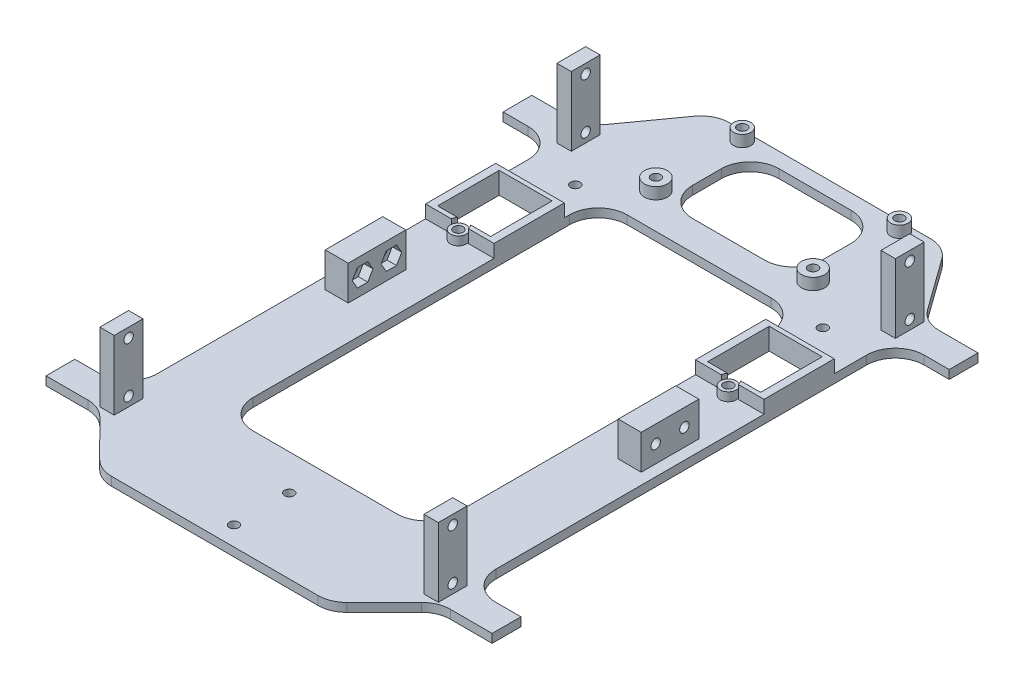
from build123d import *

# Parameters (mm, degrees)
SKETCH1_R               = 1.65
SKETCH1_W               = 70
SKETCH1_H               = 130
SKETCH1_W_2             = 45
SKETCH1_H_2             = 30
SKETCH1_W_3             = 18.4
SKETCH1_H_3             = 21.4
BOSS_EXTRUDE1_DEPTH     = 3
SKETCH3_W               = 5
SKETCH3_H               = 10
BOSS_EXTRUDE2_DEPTH     = 24
CUT_EXTRUDE1_DEPTH      = 186.477425086
CUT_EXTRUDE1_DEPTH_BACK = 186.477425086
SKETCH4_R               = 1.65
FILLET1_R               = 10
SKETCH5_W               = 8
SKETCH5_H               = 20
BOSS_EXTRUDE3_DEPTH     = 12
CUT_EXTRUDE2_DEPTH      = 181.658642795
CUT_EXTRUDE2_DEPTH_BACK = 181.658642795
SKETCH6_R               = 1.65
CUT_EXTRUDE3_DEPTH      = 3.3
CUT_EXTRUDE4_DEPTH      = 3.3
BOSS_EXTRUDE4_START     = -3
SKETCH9_R               = 2.75
BOSS_EXTRUDE4_DEPTH     = 6
CUT_EXTRUDE5_DEPTH      = 232.602495715
CUT_EXTRUDE5_DEPTH_BACK = 232.602495715
SKETCH10_R              = 1.65
BOSS_EXTRUDE6_DEPTH     = 4.5
SKETCH14_R              = 4
SKETCH14_R_2            = 1.65
SKETCH14_R_3            = 3
BOSS_EXTRUDE7_DEPTH     = 4


with BuildPart() as part:
    # Sketch1 → Boss-Extrude1 (new body)
    with BuildSketch(Plane(origin=(0, 0, 0), x_dir=(1, 0, 0), z_dir=(0, 1, 0))):
        Polygon((-154.243398335, 85.558014227), (-74.243398335, 85.558014227), (-55.443398335, 59.458014227), (-36.743398335, 59.458014227), (-36.743398335, 49.458014227), (-55.443398335, 49.458014227), (-55.443398335, -99.341985773), (-36.743398335, -99.341985773), (-36.743398335, -109.341985773), (-55.443398335, -109.341985773), (-74.243398335, -128.191985773), (-154.243398335, -128.191985773), (-173.043398335, -109.341985773), (-191.743398335, -109.341985773), (-191.743398335, -99.341985773), (-173.043398335, -99.341985773), (-173.043398335, 49.458014227), (-191.743398335, 49.458014227), (-191.743398335, 59.458014227), (-173.043398335, 59.458014227), align=None)
        with Locations(Location((-114.243398335, -121.541985773, 0), (0, 0, 270))):
            Circle(SKETCH1_R, mode=Mode.SUBTRACT)
        with Locations(Location((-114.243398335, -102.341985773, 0), (0, 0, 270))):
            Circle(SKETCH1_R, mode=Mode.SUBTRACT)
        with Locations(Location((-141.543398335, 82.358014227, 0), (0, 0, 270))):
            Circle(SKETCH1_R, mode=Mode.SUBTRACT)
        with Locations(Location((-86.943398335, 82.358014227, 0), (0, 0, 270))):
            Circle(SKETCH1_R, mode=Mode.SUBTRACT)
        with Locations(Location((-157.243398335, 40.058014227, 0), (0, 0, 270))):
            Circle(SKETCH1_R, mode=Mode.SUBTRACT)
        with Locations(Location((-71.243398335, 40.058014227, 0), (0, 0, 270))):
            Circle(SKETCH1_R, mode=Mode.SUBTRACT)
        with Locations(Location((-141.543398335, 52.358014227, 0), (0, 0, 270))):
            Circle(SKETCH1_R, mode=Mode.SUBTRACT)
        with Locations(Location((-86.943398335, 52.358014227, 0), (0, 0, 270))):
            Circle(SKETCH1_R, mode=Mode.SUBTRACT)
        with Locations((-114.243398335, -24.941985773)):
            Rectangle(SKETCH1_W, SKETCH1_H, mode=Mode.SUBTRACT)
        with Locations((-114.243398335, 65.308014227)):
            Rectangle(SKETCH1_W_2, SKETCH1_H_2, mode=Mode.SUBTRACT)
        with Locations((-161.143398335, 16.021247588)):
            Rectangle(SKETCH1_W_3, SKETCH1_H_3, mode=Mode.SUBTRACT)
        with Locations((-67.343398335, 16.021247588)):
            Rectangle(SKETCH1_W_3, SKETCH1_H_3, mode=Mode.SUBTRACT)
    extrude(amount=BOSS_EXTRUDE1_DEPTH)

    # Sketch3 → Boss-Extrude2 (add)
    with BuildSketch(Plane(origin=(0, 3, 0), x_dir=(1, 0, 0), z_dir=(0, 1, 0))):
        with Locations((-57.943398335, 54.458014227)):
            Rectangle(SKETCH3_W, SKETCH3_H)
        with Locations((-170.543398335, -104.341985773)):
            Rectangle(SKETCH3_W, SKETCH3_H)
        with Locations((-57.943398335, -104.341985773)):
            Rectangle(SKETCH3_W, SKETCH3_H)
        with Locations((-170.543398335, 54.458014227)):
            Rectangle(SKETCH3_W, SKETCH3_H)
    extrude(amount=BOSS_EXTRUDE2_DEPTH)

    # Sketch4 → Cut-Extrude1 (cut, two sides: drawn at the far end of the back side and taken through both)
    with BuildSketch(Plane(origin=(-168.043398335, 0, 0), x_dir=(0, 0, -1), z_dir=(1, 0, 0)).offset(-CUT_EXTRUDE1_DEPTH_BACK)):
        with Locations((-104.341985773, 23.75)):
            Circle(SKETCH4_R)
        with Locations((-104.341985773, 6.25)):
            Circle(SKETCH4_R)
        with Locations((54.458014227, 23.75)):
            Circle(SKETCH4_R)
        with Locations((54.458014227, 6.25)):
            Circle(SKETCH4_R)
    extrude(amount=CUT_EXTRUDE1_DEPTH + CUT_EXTRUDE1_DEPTH_BACK, mode=Mode.SUBTRACT)

    # Fillet1
    # the kernel refuses this fillet: 10 mm, written as the material it adds along each edge
    with BuildSketch(Plane(origin=(-149.243398335, 0, -40.058014227), x_dir=(0, 0, 1), z_dir=(0, 1, 0)), Plane(origin=(-136.743398335, 0, -80.308014227), x_dir=(0, 0, 1), z_dir=(0, 1, 0))) as fillet1_piece_1:
        with BuildLine():
            CenterArc((FILLET1_R, FILLET1_R), FILLET1_R, 180, 90)
            Line((0, FILLET1_R), (0, 0))
            Line((0, 0), (FILLET1_R, 0))
        make_face()
    extrude(amount=3)
    with BuildSketch(Plane(origin=(-149.243398335, 0, 89.941985773), x_dir=(0, 0, -1), z_dir=(0, 1, 0)), Plane(origin=(-79.243398335, 0, 89.941985773), x_dir=(-1, 0, 0), z_dir=(0, 1, 0)), Plane(origin=(-79.243398335, 0, -40.058014227), x_dir=(0, 0, 1), z_dir=(0, 1, 0)), Plane(origin=(-136.743398335, 0, -50.308014227), x_dir=(0, 0, -1), z_dir=(0, 1, 0)), Plane(origin=(-91.743398335, 0, -50.308014227), x_dir=(-1, 0, 0), z_dir=(0, 1, 0)), Plane(origin=(-91.743398335, 0, -80.308014227), x_dir=(0, 0, 1), z_dir=(0, 1, 0)), Plane(origin=(-173.043398335, 0, 99.341985773), x_dir=(-1, 0, 0), z_dir=(0, 1, 0)), Plane(origin=(-173.043398335, 0, -49.458014227), x_dir=(0, 0, 1), z_dir=(0, 1, 0)), Plane(origin=(-55.443398335, 0, -49.458014227), x_dir=(1, 0, 0), z_dir=(0, 1, 0)), Plane(origin=(-55.443398335, 0, 99.341985773), x_dir=(0, 0, -1), z_dir=(0, 1, 0))) as fillet1_piece_2:
        with BuildLine():
            CenterArc((FILLET1_R, -FILLET1_R), FILLET1_R, 90, 90)
            Line((0, -FILLET1_R), (0, 0))
            Line((0, 0), (FILLET1_R, 0))
        make_face()
    extrude(amount=3)
    with BuildSketch(Plane(origin=(-55.443398335, 0, 109.341985773), x_dir=(1, 0, 0), z_dir=(0, 1, 0)), Plane(origin=(-173.043398335, 0, 109.341985773), x_dir=(0.7061671056441303, 0, 0.7080452096485021), z_dir=(0, 1, 0))) as fillet1_piece_3:
        with BuildLine():
            CenterArc((FILLET1_R * 0.41499171289, -FILLET1_R), FILLET1_R, 90, 45.076089968)
            Line((-FILLET1_R * 0.293053496758, -FILLET1_R * 0.293832894356), (0, 0))
            Line((0, 0), (FILLET1_R * 0.41499171289, 0))
        make_face()
    extrude(amount=3)
    with BuildSketch(Plane(origin=(-173.043398335, 0, -59.458014227), x_dir=(0.5844685113648759, 0, -0.8114163907778335), z_dir=(0, 1, 0))) as fillet1_piece_4:
        with BuildLine():
            CenterArc((FILLET1_R * 0.512106352987, FILLET1_R), FILLET1_R, 215.765451646, 54.234548354)
            Line((-FILLET1_R * 0.299310037791, FILLET1_R * 0.415531488635), (0, 0))
            Line((0, 0), (FILLET1_R * 0.512106352987, 0))
        make_face()
    extrude(amount=3)
    with BuildSketch(Plane(origin=(-55.443398335, 0, -59.458014227), x_dir=(-0.5844685113648771, 0, -0.8114163907778328), z_dir=(0, 1, 0))) as fillet1_piece_5:
        with BuildLine():
            CenterArc((FILLET1_R * 0.512106352987, -FILLET1_R), FILLET1_R, 90, 54.234548354)
            Line((-FILLET1_R * 0.299310037791, -FILLET1_R * 0.415531488635), (0, 0))
            Line((0, 0), (FILLET1_R * 0.512106352987, 0))
        make_face()
    extrude(amount=3)
    # the kernel refuses this fillet: 10 mm, written as the material it takes off along each edge
    with BuildSketch(Plane(origin=(-74.243398335, -10.374792822, 128.191985773), x_dir=(0.7061671056441304, 0, -0.7080452096485023), z_dir=(0, 1, 0)), Plane(origin=(-154.243398335, -10.374792822, 128.191985773), x_dir=(1, 0, 0), z_dir=(0, 1, 0))) as fillet1_2_piece_1:
        with BuildLine():
            CenterArc((FILLET1_R * 0.41499171289, FILLET1_R), FILLET1_R, 224.923910032, 45.076089968)
            Line((-FILLET1_R * 0.293053496758, FILLET1_R * 0.293832894356), (0, 0))
            Line((0, 0), (FILLET1_R * 0.41499171289, 0))
        make_face()
    extrude(amount=23.749585645, mode=Mode.SUBTRACT)
    with BuildSketch(Plane(origin=(-154.243398335, -12.802658825, -85.558014227), x_dir=(1, 0, 0), z_dir=(0, 1, 0))) as fillet1_2_piece_2:
        with BuildLine():
            CenterArc((FILLET1_R * 0.512106352987, -FILLET1_R), FILLET1_R, 90, 54.234548354)
            Line((-FILLET1_R * 0.299310037791, -FILLET1_R * 0.415531488635), (0, 0))
            Line((0, 0), (FILLET1_R * 0.512106352987, 0))
        make_face()
    extrude(amount=28.605317649, mode=Mode.SUBTRACT)
    with BuildSketch(Plane(origin=(-74.243398335, -12.802658825, -85.558014227), x_dir=(-1, 0, 0), z_dir=(0, 1, 0))) as fillet1_2_piece_3:
        with BuildLine():
            CenterArc((FILLET1_R * 0.512106352987, FILLET1_R), FILLET1_R, 215.765451646, 54.234548354)
            Line((-FILLET1_R * 0.299310037791, FILLET1_R * 0.415531488635), (0, 0))
            Line((0, 0), (FILLET1_R * 0.512106352987, 0))
        make_face()
    extrude(amount=28.605317649, mode=Mode.SUBTRACT)

    # Sketch5 → Boss-Extrude3 (add)
    with BuildSketch(Plane(origin=(0, 3, 0), x_dir=(1, 0, 0), z_dir=(0, 1, 0))):
        with Locations((-165.143398335, -24.941985773)):
            Rectangle(SKETCH5_W, SKETCH5_H)
        with Locations((-63.343398335, -24.941985773)):
            Rectangle(SKETCH5_W, SKETCH5_H)
    extrude(amount=BOSS_EXTRUDE3_DEPTH)

    # Sketch6 → Cut-Extrude2 (cut, two sides: drawn at the far end of the back side and taken through both)
    with BuildSketch(Plane(origin=(-161.143398335, 0, 0), x_dir=(0, 0, -1), z_dir=(1, 0, 0)).offset(-CUT_EXTRUDE2_DEPTH_BACK)):
        with Locations((-29.941985773, 9)):
            Circle(SKETCH6_R)
        with Locations((-19.941985773, 9)):
            Circle(SKETCH6_R)
    extrude(amount=CUT_EXTRUDE2_DEPTH + CUT_EXTRUDE2_DEPTH_BACK, mode=Mode.SUBTRACT)

    # Sketch7 → Cut-Extrude3 (cut)
    with BuildSketch(Plane(origin=(-161.143398335, 0, 0), x_dir=(0, 0, -1), z_dir=(1, 0, 0))):
        Polygon((-26.362414104, 9), (-28.152199939, 12.1), (-31.731771608, 12.1), (-33.521557442, 9), (-31.731771608, 5.9), (-28.152199939, 5.9), align=None)
        Polygon((-16.362414104, 9), (-18.152199939, 12.1), (-21.731771608, 12.1), (-23.521557442, 9), (-21.731771608, 5.9), (-18.152199939, 5.9), align=None)
    extrude(amount=-CUT_EXTRUDE3_DEPTH, mode=Mode.SUBTRACT)

    # Sketch8 → Cut-Extrude4 (cut)
    with BuildSketch(Plane.ZY.offset(67.343398335)):
        Polygon((23.521557442, 9), (21.731771608, 12.1), (18.152199939, 12.1), (16.362414104, 9), (18.152199939, 5.9), (21.731771608, 5.9), align=None)
        Polygon((26.362414104, 9), (28.152199939, 5.9), (31.731771608, 5.9), (33.521557442, 9), (31.731771608, 12.1), (28.152199939, 12.1), align=None)
    extrude(amount=-CUT_EXTRUDE4_DEPTH, mode=Mode.SUBTRACT)

    # Sketch9 → Boss-Extrude4 (add)
    with BuildSketch(Plane(origin=(0, 3, 0), x_dir=(1, 0, 0), z_dir=(0, 1, 0)).offset(BOSS_EXTRUDE4_START)):
        with Locations(Location((-161.143398335, 3.321247588, 0), (0, 0, 270))):
            Circle(SKETCH9_R)
        with Locations(Location((-67.343398335, 3.321247588, 0), (0, 0, 270))):
            Circle(SKETCH9_R)
    extrude(amount=BOSS_EXTRUDE4_DEPTH)

    # Sketch10 → Cut-Extrude5 (cut, two sides: drawn at the far end of the back side and taken through both)
    with BuildSketch(Plane(origin=(0, 6, 0), x_dir=(1, 0, 0), z_dir=(0, 1, 0)).offset(-CUT_EXTRUDE5_DEPTH_BACK)):
        with Locations(Location((-161.143398335, 3.321247588, 0), (0, 0, 270))):
            Circle(SKETCH10_R)
        with Locations(Location((-67.343398335, 3.321247588, 0), (0, 0, 270))):
            Circle(SKETCH10_R)
    extrude(amount=CUT_EXTRUDE5_DEPTH + CUT_EXTRUDE5_DEPTH_BACK, mode=Mode.SUBTRACT)

    # Sketch11 → Boss-Extrude6 (add)
    with BuildSketch(Plane(origin=(0, 3, 0), x_dir=(1, 0, 0), z_dir=(0, 1, 0))):
        with BuildLine():
            Line((-149.243398335, 28.221247588), (-173.043398335, 28.221247588))
            Line((-173.043398335, 28.221247588), (-173.043398335, 3.821247588))
            Line((-173.043398335, 3.821247588), (-164.101438226, 3.821247588))
            ThreePointArc((-164.101438226, 3.821247588), (-163.846579634, 4.622328239), (-163.379466312, 5.321247588))
            Line((-163.379466312, 5.321247588), (-170.343398335, 5.321247588))
            Line((-170.343398335, 5.321247588), (-170.343398335, 26.721247588))
            Line((-170.343398335, 26.721247588), (-151.943398335, 26.721247588))
            Line((-151.943398335, 26.721247588), (-151.943398335, 5.321247588))
            Line((-151.943398335, 5.321247588), (-158.907330357, 5.321247588))
            ThreePointArc((-158.907330357, 5.321247588), (-158.440217035, 4.622328239), (-158.185358443, 3.821247588))
            Line((-158.185358443, 3.821247588), (-149.243398335, 3.821247588))
            Line((-149.243398335, 3.821247588), (-149.243398335, 28.221247588))
        make_face()
        with BuildLine():
            Line((-55.443398335, 28.221247588), (-79.243398335, 28.221247588))
            Line((-79.243398335, 28.221247588), (-79.243398335, 3.821247588))
            Line((-79.243398335, 3.821247588), (-70.301438226, 3.821247588))
            ThreePointArc((-70.301438226, 3.821247588), (-70.046579634, 4.622328239), (-69.579466312, 5.321247588))
            Line((-69.579466312, 5.321247588), (-76.543398335, 5.321247588))
            Line((-76.543398335, 5.321247588), (-76.543398335, 26.721247588))
            Line((-76.543398335, 26.721247588), (-58.143398335, 26.721247588))
            Line((-58.143398335, 26.721247588), (-58.143398335, 5.321247588))
            Line((-58.143398335, 5.321247588), (-65.107330357, 5.321247588))
            ThreePointArc((-65.107330357, 5.321247588), (-64.640217035, 4.622328239), (-64.385358443, 3.821247588))
            Line((-64.385358443, 3.821247588), (-55.443398335, 3.821247588))
            Line((-55.443398335, 3.821247588), (-55.443398335, 28.221247588))
        make_face()
    extrude(amount=BOSS_EXTRUDE6_DEPTH)

    # Sketch14 → Boss-Extrude7 (add)
    # profile 1 of 4: a face of its own
    with BuildSketch(Plane(origin=(0, 3, 0), x_dir=(1, 0, 0), z_dir=(0, 1, 0))):
        with Locations(Location((-141.543398335, 52.358014227, 0), (0, 0, 270))):
            Circle(SKETCH14_R)
        with Locations(Location((-141.543398335, 52.358014227, 0), (0, 0, 270))):
            Circle(SKETCH14_R_2, mode=Mode.SUBTRACT)
    # profile 2 of 4: a face of its own
    with BuildSketch(Plane(origin=(0, 3, 0), x_dir=(1, 0, 0), z_dir=(0, 1, 0))):
        with Locations(Location((-141.543398335, 82.358014227, 0), (0, 0, 270))):
            Circle(SKETCH14_R_3)
        with Locations(Location((-141.543398335, 82.358014227, 0), (0, 0, 270))):
            Circle(SKETCH14_R_2, mode=Mode.SUBTRACT)
    # profile 3 of 4: a face of its own
    with BuildSketch(Plane(origin=(0, 3, 0), x_dir=(1, 0, 0), z_dir=(0, 1, 0))):
        with Locations(Location((-86.943398335, 82.358014227, 0), (0, 0, 270))):
            Circle(SKETCH14_R_3)
        with Locations(Location((-86.943398335, 82.358014227, 0), (0, 0, 270))):
            Circle(SKETCH14_R_2, mode=Mode.SUBTRACT)
    # profile 4 of 4: a face of its own
    with BuildSketch(Plane(origin=(0, 3, 0), x_dir=(1, 0, 0), z_dir=(0, 1, 0))):
        with Locations(Location((-86.943398335, 52.358014227, 0), (0, 0, 270))):
            Circle(SKETCH14_R)
        with Locations(Location((-86.943398335, 52.358014227, 0), (0, 0, 270))):
            Circle(SKETCH14_R_2, mode=Mode.SUBTRACT)
    extrude(amount=BOSS_EXTRUDE7_DEPTH)


solid = part.part
